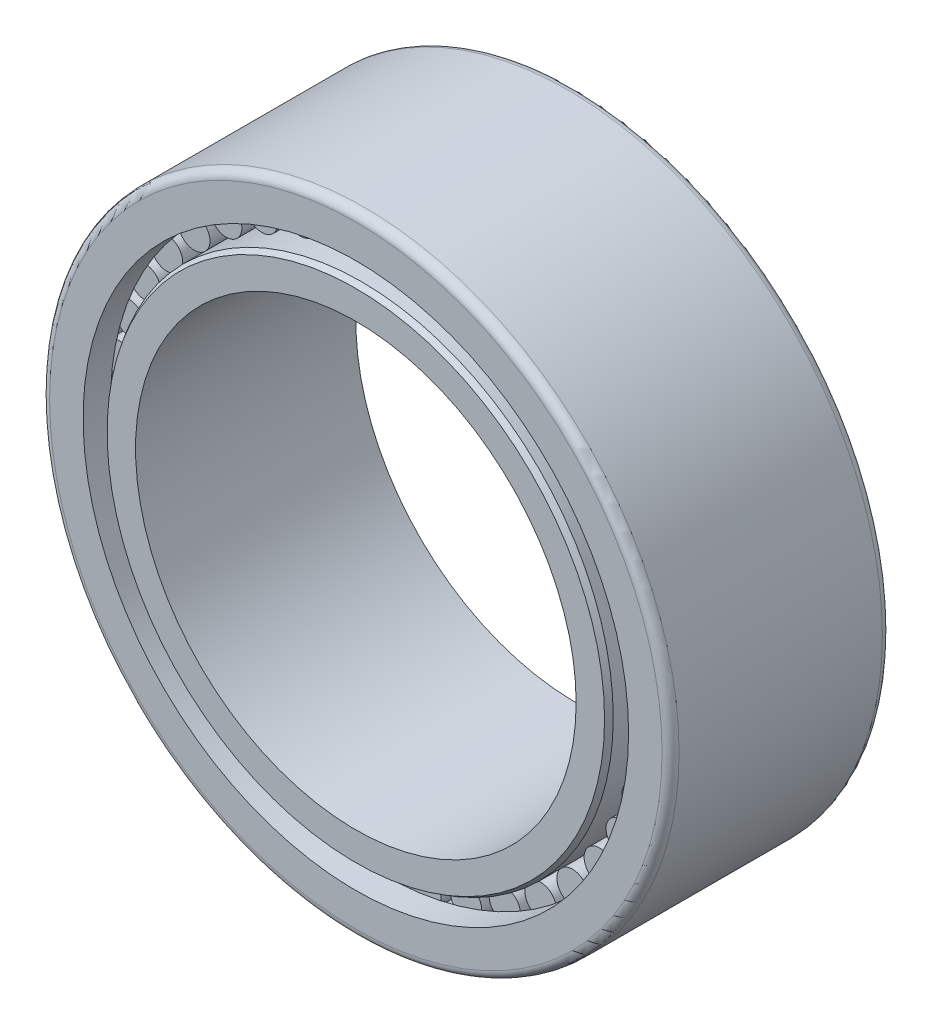
from build123d import *

# Parameters (mm, degrees)
BASESKE_W            = 26.25
BASESKE_H            = 2.5
FILLET1_R            = 1.35
CIRPATTERNBALL_COUNT = 40


with BuildPart() as part:
    # BaseSke → Roller (revolve)
    with BuildSketch(Plane(origin=(0, 0, 0), x_dir=(0, 0, -1), z_dir=(1, 0, 0))):
        with Locations((0, 41.25)):
            Rectangle(BASESKE_W, BASESKE_H)
    roller = revolve(axis=Axis((0, 42.5, 13.125), (0, 0, -1)))

    # OuterRaceSke → OuterRace (revolve)
    with BuildSketch(Plane(origin=(0, 0, 0), x_dir=(0, 0, -1), z_dir=(1, 0, 0))):
        Polygon((-17.5, 50), (17.5, 50), (17.5, 43.333333333), (13.15, 43.333333333), (13.15, 44.98), (-13.15, 44.98), (-13.15, 43.333333333), (-17.5, 43.333333333), align=None)
    revolve(axis=Axis((0, 0, 50.391616343), (0, 0, -1)))

    # InnerRaceSke → InnerRace (revolve)
    with BuildSketch(Plane(origin=(0, 0, 0), x_dir=(0, 0, -1), z_dir=(1, 0, 0))):
        Polygon((-17.5, 35), (17.5, 35), (17.5, 39.514818514), (16.625, 40.02), (-16.625, 40.02), (-17.5, 39.514818514), align=None)
    revolve(axis=Axis((0, 0, 70.862590906), (0, 0, -1)))

    # Fillet1
    fillet1_edges = [part.edges().sort_by_distance(p)[0] for p in [
        (0, -50, -17.5),
        (0, -50, 17.5),
    ]]
    fillet(fillet1_edges, radius=FILLET1_R)

    # CirPatternBall: Roller ×40 about axis
    cirpatternball_axis = Axis((0, 0, 50.391616343), (0, 0, -1))
    for i in range(1, CIRPATTERNBALL_COUNT):
        add(roller.rotate(cirpatternball_axis, i * 360 / CIRPATTERNBALL_COUNT))


solid = part.part
